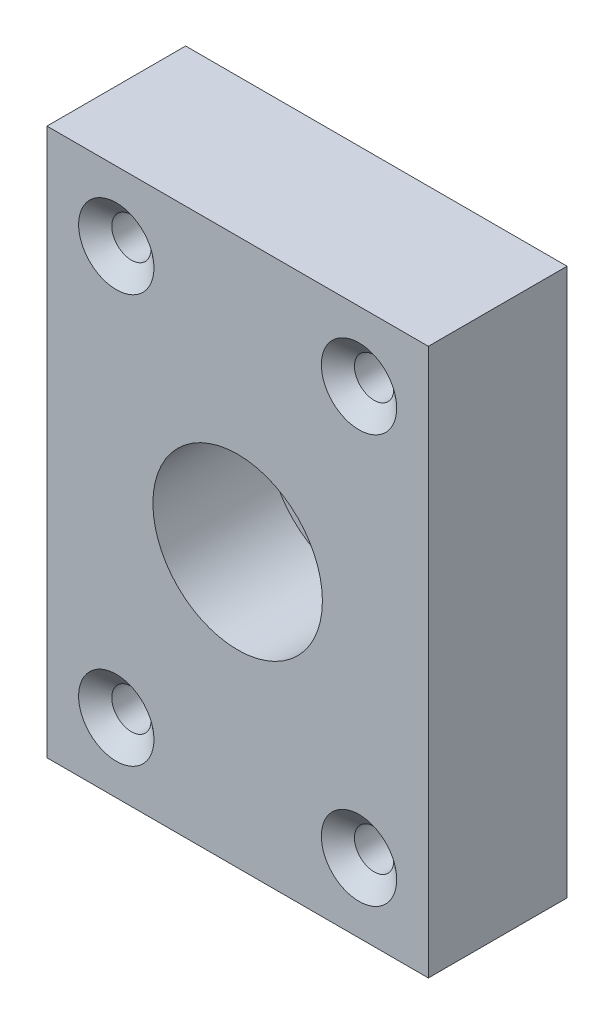
from build123d import *

# Parameters (mm, degrees)
SKETCH1_W                       = 49.5
SKETCH1_H                       = 71
BASE_DEPTH                      = 18
SKETCH2_R                       = 11
LEAD_NUT_INLAY_DEPTH            = 15
SKETCH3_R                       = 6.5
LEAD_SCREW_CLEARANCE_DEPTH      = 88.842188042
WOODSCREW_CLEARANCE_D           = 5.1054
WOODSCREW_CLEARANCE_CSINK_D     = 9.779
WOODSCREW_CLEARANCE_CSINK_ANGLE = 100


with BuildPart() as part:
    # Sketch1 → base (new body)
    with BuildSketch(Plane.XY):
        with Locations((24.75, 35.5)):
            Rectangle(SKETCH1_W, SKETCH1_H)
    extrude(amount=BASE_DEPTH)

    # Sketch2 → lead nut inlay (cut)
    with BuildSketch(Plane.XY.offset(18)):
        with Locations((24.75, 35.5)):
            Circle(SKETCH2_R)
    extrude(amount=-LEAD_NUT_INLAY_DEPTH, mode=Mode.SUBTRACT)

    # Sketch3 → lead screw clearance (cut, through all)
    with BuildSketch(Plane.XY.offset(3)):
        with Locations((24.75, 35.5)):
            Circle(SKETCH3_R)
    extrude(amount=-LEAD_SCREW_CLEARANCE_DEPTH, mode=Mode.SUBTRACT)

    # woodscrew clearance (through all)
    with Locations(Plane.XY.offset(18)):
        with Locations((9, 9), (40.5, 62), (9, 62), (40.5, 9)):
            CounterSinkHole(WOODSCREW_CLEARANCE_D / 2, WOODSCREW_CLEARANCE_CSINK_D / 2, counter_sink_angle=WOODSCREW_CLEARANCE_CSINK_ANGLE)


solid = part.part
